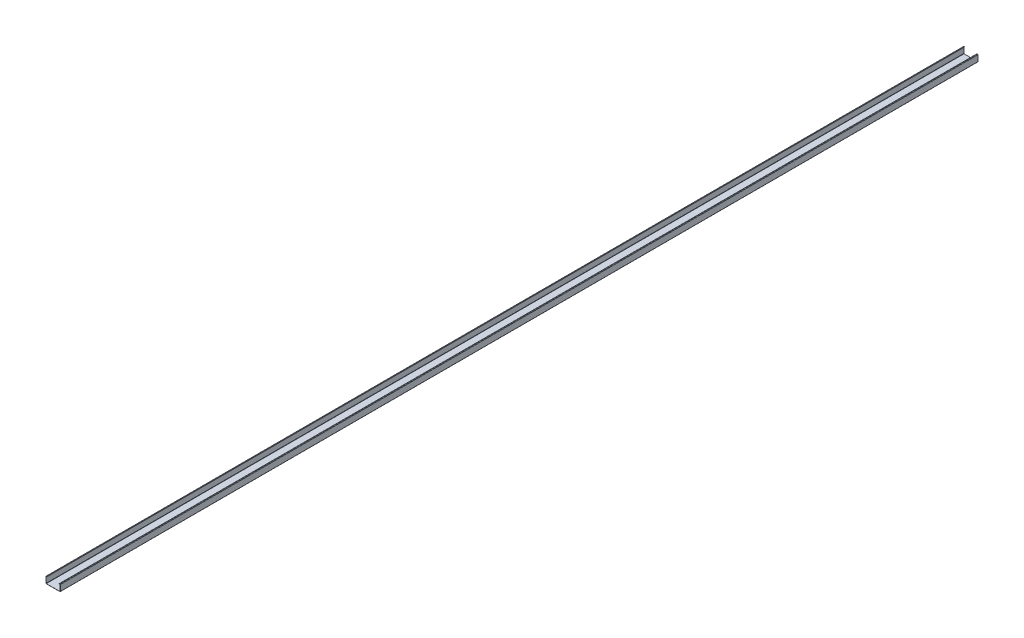
from build123d import *

# Parameters (mm, degrees)
SM_BASE_FLANGE_1_DEPTH = 3925


# Sheet-metal steps are written as plain solids
with BuildPart() as part:
    # Sketch 1 → Базовая кромка1 (new body)
    with BuildSketch(Plane.XY):
        with BuildLine():
            Line((-26, 27), (-29.25, 27))
            ThreePointArc((-29.25, 27), (-29.780330086, 26.780330086), (-30, 26.25))
            Line((-30, 26.25), (-30, 0.75))
            ThreePointArc((-30, 0.75), (-29.780330086, 0.219669914), (-29.25, 0))
            Line((-29.25, 0), (29.25, 0))
            ThreePointArc((29.25, 0), (29.780330086, 0.219669914), (30, 0.75))
            Line((30, 0.75), (30, 26.25))
            ThreePointArc((30, 26.25), (29.780330086, 26.780330086), (29.25, 27))
            Line((29.25, 27), (26, 27))
            Line((26, 27), (26, 27.5))
            Line((26, 27.5), (29.25, 27.5))
            ThreePointArc((29.25, 27.5), (30.133883476, 27.133883476), (30.5, 26.25))
            Line((30.5, 26.25), (30.5, 0.75))
            ThreePointArc((30.5, 0.75), (30.133883476, -0.133883476), (29.25, -0.5))
            Line((29.25, -0.5), (-29.25, -0.5))
            ThreePointArc((-29.25, -0.5), (-30.133883476, -0.133883476), (-30.5, 0.75))
            Line((-30.5, 0.75), (-30.5, 26.25))
            ThreePointArc((-30.5, 26.25), (-30.133883476, 27.133883476), (-29.25, 27.5))
            Line((-29.25, 27.5), (-26, 27.5))
            Line((-26, 27.5), (-26, 27))
        make_face()
    extrude(amount=-SM_BASE_FLANGE_1_DEPTH)


solid = part.part
